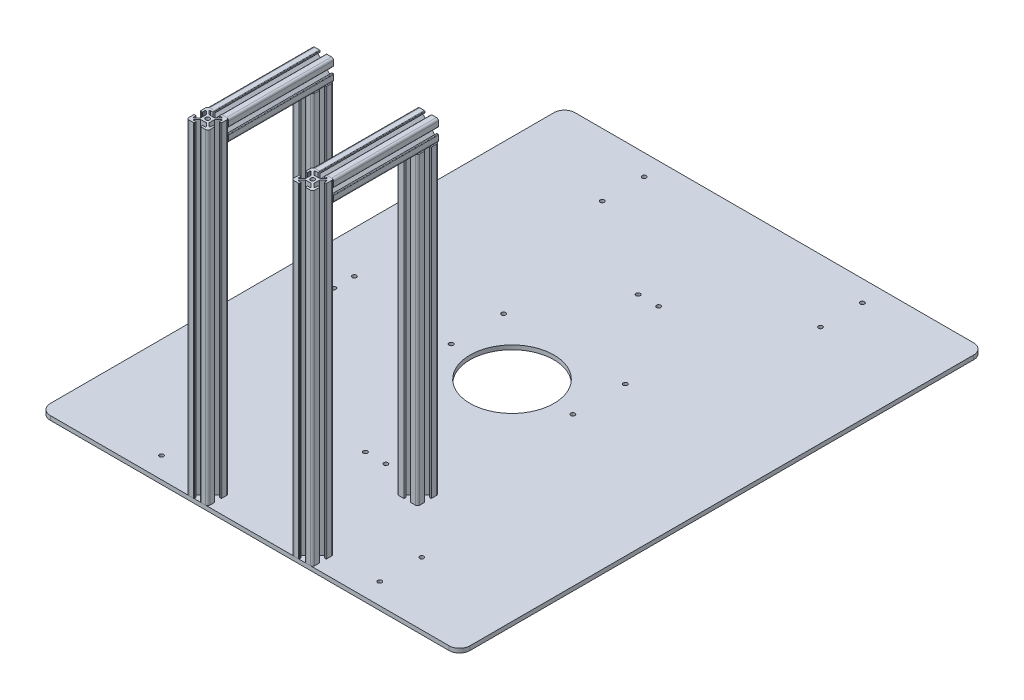
from build123d import *
from OCP.BRepAlgoAPI import BRepAlgoAPI_Cut
from OCP.TopTools import TopTools_ListOfShape

# Parameters (mm, degrees)
SKETCH1_W                             = 400
SKETCH1_H                             = 500
SKETCH1_R                             = 40
BOSS_EXTRUDE1_DEPTH                   = 4
ALUMINIUM_START                       = 4
ALUMINIUM_PROFILE_20_20_2_OUTLINE_R   = 2
ALUMINIUM_PROFILE_20_20_2_DEPTH       = 310
ALUMINIUM_START_2                     = 130
ALUMINIUM_PROFILE_20_20_2_2_OUTLINE_R = 2
ALUMINIUM_PROFILE_20_20_2_2_DEPTH     = 100
ALUMINIUM_PROFILE_20_20_2_3_OUTLINE_R = 2
ALUMINIUM_PROFILE_20_20_2_3_DEPTH     = 290
ALUMINIUM_PROFILE_20_20_2_4_OUTLINE_R = 2
ALUMINIUM_PROFILE_20_20_2_4_DEPTH     = 310
ALUMINIUM_PROFILE_20_20_2_5_OUTLINE_R = 2
ALUMINIUM_PROFILE_20_20_2_5_DEPTH     = 100
ALUMINIUM_PROFILE_20_20_2_6_OUTLINE_R = 2
ALUMINIUM_PROFILE_20_20_2_6_DEPTH     = 290
SKETCH4_R                             = 2
CUT_EXTRUDE1_DEPTH                    = 10
SKETCH5_R                             = 2
CUT_EXTRUDE2_DEPTH                    = 10
SKETCH6_R                             = 2
CUT_EXTRUDE3_DEPTH                    = 10
FILLET1_R                             = 10
SKETCH7_R                             = 2
CUT_EXTRUDE4_DEPTH                    = 10


with BuildPart() as part:
    # Sketch1 → Boss-Extrude1 (new body)
    with BuildSketch(Plane(origin=(0, 0, 0), x_dir=(1, 0, 0), z_dir=(0, 1, 0))):
        Rectangle(SKETCH1_W, SKETCH1_H)
        with Locations(Location((0, 0, 0), (0, 0, 270))):
            Circle(SKETCH1_R, mode=Mode.SUBTRACT)
    extrude(amount=BOSS_EXTRUDE1_DEPTH)

    # Sketch5 → Cut-Extrude2 (cut)
    with BuildSketch(Plane.XZ):
        with Locations(Location((-58, -50, 0), (0, 0, 270))):
            Circle(SKETCH5_R)
        with Locations(Location((-58, 0, 0), (0, 0, 270))):
            Circle(SKETCH5_R)
        with Locations(Location((58, 0, 0), (0, 0, 270))):
            Circle(SKETCH5_R)
        with Locations(Location((58, -50, 0), (0, 0, 270))):
            Circle(SKETCH5_R)
    extrude(amount=-CUT_EXTRUDE2_DEPTH, mode=Mode.SUBTRACT)

    # Sketch6 → Cut-Extrude3 (cut)
    with BuildSketch(Plane.XZ):
        with Locations(Location((104, 230, 0), (0, 0, 270))):
            Circle(SKETCH6_R)
        with Locations(Location((104, 190, 0), (0, 0, 270))):
            Circle(SKETCH6_R)
        with Locations(Location((-104, 190, 0), (0, 0, 270))):
            Circle(SKETCH6_R)
        with Locations(Location((-104, 230, 0), (0, 0, 270))):
            Circle(SKETCH6_R)
        with Locations(Location((104, -190, 0), (0, 0, 270))):
            Circle(SKETCH6_R)
        with Locations(Location((104, -230, 0), (0, 0, 270))):
            Circle(SKETCH6_R)
        with Locations(Location((-104, -190, 0), (0, 0, 270))):
            Circle(SKETCH6_R)
        with Locations(Location((-104, -230, 0), (0, 0, 270))):
            Circle(SKETCH6_R)
    extrude(amount=-CUT_EXTRUDE3_DEPTH, mode=Mode.SUBTRACT)

    # Fillet1
    fillet1_edges = [part.edges().sort_by_distance(p)[0] for p in [
        (200, 2, 250),
        (-200, 2, 250),
        (-200, 2, -250),
        (200, 2, -250),
    ]]
    fillet(fillet1_edges, radius=FILLET1_R)

    # Sketch7 → Cut-Extrude4 (cut)
    with BuildSketch(Plane.XZ):
        with Locations(Location((9.75, -130, 0), (0, 0, 270))):
            Circle(SKETCH7_R)
        with Locations(Location((-9.75, -130, 0), (0, 0, 270))):
            Circle(SKETCH7_R)
        with Locations(Location((-9.75, 130, 0), (0, 0, 270))):
            Circle(SKETCH7_R)
        with Locations(Location((9.75, 130, 0), (0, 0, 270))):
            Circle(SKETCH7_R)
        with Locations(Location((-160, 9.75, 0), (0, 0, 270))):
            Circle(SKETCH7_R)
        with Locations(Location((-160, -9.75, 0), (0, 0, 270))):
            Circle(SKETCH7_R)
    extrude(amount=-CUT_EXTRUDE4_DEPTH, mode=Mode.SUBTRACT)


with BuildPart() as body_2:
    # Aluminium profile 20×20(2): read off the stored shape, not the designer's step
    # Aluminium profile 20×20(2) outline → Aluminium profile 20×20(2) (new body)
    with BuildSketch(Plane(origin=(0, 0, 0), x_dir=(1, 0, 0), z_dir=(0, 1, 0)).offset(ALUMINIUM_START)):
        with BuildLine():
            ThreePointArc((-42.001429645, -250), (-40.587216083, -249.414213562), (-40.001429645, -248))
            Line((-40.001429645, -248), (-40.001429645, -243.5))
            ThreePointArc((-40.001429645, -243.5), (-40.147876254, -243.146446609), (-40.501429645, -243))
            Line((-40.501429645, -243), (-41.501429645, -243))
            ThreePointArc((-41.501429645, -243), (-41.854983036, -243.146446609), (-42.001429645, -243.5))
            Line((-42.001429645, -243.5), (-42.001429645, -245.412091861))
            ThreePointArc((-42.001429645, -245.412091861), (-42.308999453, -245.873579263), (-42.853312131, -245.767308297))
            Line((-42.853312131, -245.767308297), (-46, -242.650154242))
            Line((-46, -242.650154242), (-46, -237.349845758))
            Line((-46, -237.349845758), (-42.853312131, -234.232691703))
            ThreePointArc((-42.853312131, -234.232691703), (-42.308999453, -234.126420737), (-42.001429645, -234.587908139))
            Line((-42.001429645, -234.587908139), (-42.001429645, -236.5))
            ThreePointArc((-42.001429645, -236.5), (-41.854983036, -236.853553391), (-41.501429645, -237))
            Line((-41.501429645, -237), (-40.501429645, -237))
            ThreePointArc((-40.501429645, -237), (-40.147876254, -236.853553391), (-40.001429645, -236.5))
            Line((-40.001429645, -236.5), (-40.001429645, -232))
            ThreePointArc((-40.001429645, -232), (-40.587216083, -230.585786438), (-42.001429645, -230))
            Line((-42.001429645, -230), (-46.501429645, -230))
            ThreePointArc((-46.501429645, -230), (-46.854983036, -230.146446609), (-47.001429645, -230.5))
            Line((-47.001429645, -230.5), (-47.001429645, -231.5))
            ThreePointArc((-47.001429645, -231.5), (-46.854983036, -231.853553391), (-46.501429645, -232))
            Line((-46.501429645, -232), (-44.579081635, -232))
            ThreePointArc((-44.579081635, -232), (-44.117734535, -232.307233683), (-44.223352909, -232.851364588))
            Line((-44.223352909, -232.851364588), (-47.333360347, -236))
            Line((-47.333360347, -236), (-52.666639653, -236))
            Line((-52.666639653, -236), (-55.776647091, -232.851364588))
            ThreePointArc((-55.776647091, -232.851364588), (-55.882265465, -232.307233683), (-55.420918365, -232))
            Line((-55.420918365, -232), (-52.998570355, -232))
            Line((-52.998570355, -232), (-52.998570355, -230))
            Line((-52.998570355, -230), (-57.998570355, -230))
            ThreePointArc((-57.998570355, -230), (-59.412783917, -230.585786438), (-59.998570355, -232))
            Line((-59.998570355, -232), (-59.998570355, -236.5))
            ThreePointArc((-59.998570355, -236.5), (-59.852123746, -236.853553391), (-59.498570355, -237))
            Line((-59.498570355, -237), (-58.498570355, -237))
            ThreePointArc((-58.498570355, -237), (-58.145016964, -236.853553391), (-57.998570355, -236.5))
            Line((-57.998570355, -236.5), (-57.998570355, -234.587908139))
            ThreePointArc((-57.998570355, -234.587908139), (-57.691000547, -234.126420737), (-57.146687869, -234.232691703))
            Line((-57.146687869, -234.232691703), (-54, -237.349845758))
            Line((-54, -237.349845758), (-54, -242.650154242))
            Line((-54, -242.650154242), (-57.146687869, -245.767308297))
            ThreePointArc((-57.146687869, -245.767308297), (-57.691000547, -245.873579263), (-57.998570355, -245.412091861))
            Line((-57.998570355, -245.412091861), (-57.998570355, -243.5))
            ThreePointArc((-57.998570355, -243.5), (-58.145016964, -243.146446609), (-58.498570355, -243))
            Line((-58.498570355, -243), (-59.498570355, -243))
            ThreePointArc((-59.498570355, -243), (-59.852123746, -243.146446609), (-59.998570355, -243.5))
            Line((-59.998570355, -243.5), (-59.998570355, -248))
            ThreePointArc((-59.998570355, -248), (-59.412783917, -249.414213562), (-57.998570355, -250))
            Line((-57.998570355, -250), (-53.498570355, -250))
            ThreePointArc((-53.498570355, -250), (-53.145016964, -249.853553391), (-52.998570355, -249.5))
            Line((-52.998570355, -249.5), (-52.998570355, -248.5))
            ThreePointArc((-52.998570355, -248.5), (-53.145016964, -248.146446609), (-53.498570355, -248))
            Line((-53.498570355, -248), (-55.420918365, -248))
            ThreePointArc((-55.420918365, -248), (-55.882265465, -247.692766317), (-55.776647091, -247.148635412))
            Line((-55.776647091, -247.148635412), (-52.666639653, -244))
            Line((-52.666639653, -244), (-47.333360347, -244))
            Line((-47.333360347, -244), (-44.223352909, -247.148635412))
            ThreePointArc((-44.223352909, -247.148635412), (-44.117734535, -247.692766317), (-44.579081635, -248))
            Line((-44.579081635, -248), (-46.501429645, -248))
            ThreePointArc((-46.501429645, -248), (-46.854983036, -248.146446609), (-47.001429645, -248.5))
            Line((-47.001429645, -248.5), (-47.001429645, -249.5))
            ThreePointArc((-47.001429645, -249.5), (-46.854983036, -249.853553391), (-46.501429645, -250))
            Line((-46.501429645, -250), (-42.001429645, -250))
        make_face()
        with Locations((-50, -240)):
            Circle(ALUMINIUM_PROFILE_20_20_2_OUTLINE_R, mode=Mode.SUBTRACT)
    extrude(amount=ALUMINIUM_PROFILE_20_20_2_DEPTH)


with BuildPart() as body_3:
    # Aluminium profile 20_20_2 2 outline → Aluminium profile 20_20_2 2 (new body)
    with BuildSketch(Plane.XY.offset(ALUMINIUM_START_2)):
        with BuildLine():
            Line((-42.001429645, 314), (-46.501429645, 314))
            ThreePointArc((-46.501429645, 314), (-46.854983036, 313.853553391), (-47.001429645, 313.5))
            Line((-47.001429645, 313.5), (-47.001429645, 312.5))
            ThreePointArc((-47.001429645, 312.5), (-46.854983036, 312.146446609), (-46.501429645, 312))
            Line((-46.501429645, 312), (-44.579081635, 312))
            ThreePointArc((-44.579081635, 312), (-44.117734535, 311.692766317), (-44.223352909, 311.148635412))
            Line((-44.223352909, 311.148635412), (-47.333360347, 308))
            Line((-47.333360347, 308), (-52.666639653, 308))
            Line((-52.666639653, 308), (-55.776647091, 311.148635412))
            ThreePointArc((-55.776647091, 311.148635412), (-55.882265465, 311.692766317), (-55.420918365, 312))
            Line((-55.420918365, 312), (-53.498570355, 312))
            ThreePointArc((-53.498570355, 312), (-53.145016964, 312.146446609), (-52.998570355, 312.5))
            Line((-52.998570355, 312.5), (-52.998570355, 313.5))
            ThreePointArc((-52.998570355, 313.5), (-53.145016964, 313.853553391), (-53.498570355, 314))
            Line((-53.498570355, 314), (-57.998570355, 314))
            ThreePointArc((-57.998570355, 314), (-59.412783917, 313.414213562), (-59.998570355, 312))
            Line((-59.998570355, 312), (-59.998570355, 307.5))
            ThreePointArc((-59.998570355, 307.5), (-59.852123746, 307.146446609), (-59.498570355, 307))
            Line((-59.498570355, 307), (-58.498570355, 307))
            ThreePointArc((-58.498570355, 307), (-58.145016964, 307.146446609), (-57.998570355, 307.5))
            Line((-57.998570355, 307.5), (-57.998570355, 309.412091861))
            ThreePointArc((-57.998570355, 309.412091861), (-57.691000547, 309.873579263), (-57.146687869, 309.767308297))
            Line((-57.146687869, 309.767308297), (-54, 306.650154242))
            Line((-54, 306.650154242), (-54, 301.349845758))
            Line((-54, 301.349845758), (-57.146687869, 298.232691703))
            ThreePointArc((-57.146687869, 298.232691703), (-57.691000547, 298.126420737), (-57.998570355, 298.587908139))
            Line((-57.998570355, 298.587908139), (-57.998570355, 300.5))
            ThreePointArc((-57.998570355, 300.5), (-58.145016964, 300.853553391), (-58.498570355, 301))
            Line((-58.498570355, 301), (-59.498570355, 301))
            ThreePointArc((-59.498570355, 301), (-59.852123746, 300.853553391), (-59.998570355, 300.5))
            Line((-59.998570355, 300.5), (-59.998570355, 296))
            ThreePointArc((-59.998570355, 296), (-59.412783917, 294.585786438), (-57.998570355, 294))
            Line((-57.998570355, 294), (-52.998570355, 294))
            Line((-52.998570355, 294), (-52.998570355, 296))
            Line((-52.998570355, 296), (-55.420918365, 296))
            ThreePointArc((-55.420918365, 296), (-55.882265465, 296.307233683), (-55.776647091, 296.851364588))
            Line((-55.776647091, 296.851364588), (-52.666639653, 300))
            Line((-52.666639653, 300), (-47.333360347, 300))
            Line((-47.333360347, 300), (-44.223352909, 296.851364588))
            ThreePointArc((-44.223352909, 296.851364588), (-44.117734535, 296.307233683), (-44.579081635, 296))
            Line((-44.579081635, 296), (-46.501429645, 296))
            ThreePointArc((-46.501429645, 296), (-46.854983036, 295.853553391), (-47.001429645, 295.5))
            Line((-47.001429645, 295.5), (-47.001429645, 294.5))
            ThreePointArc((-47.001429645, 294.5), (-46.854983036, 294.146446609), (-46.501429645, 294))
            Line((-46.501429645, 294), (-42.001429645, 294))
            ThreePointArc((-42.001429645, 294), (-40.587216083, 294.585786438), (-40.001429645, 296))
            Line((-40.001429645, 296), (-40.001429645, 300.5))
            ThreePointArc((-40.001429645, 300.5), (-40.147876254, 300.853553391), (-40.501429645, 301))
            Line((-40.501429645, 301), (-41.501429645, 301))
            ThreePointArc((-41.501429645, 301), (-41.854983036, 300.853553391), (-42.001429645, 300.5))
            Line((-42.001429645, 300.5), (-42.001429645, 298.587908139))
            ThreePointArc((-42.001429645, 298.587908139), (-42.308999453, 298.126420737), (-42.853312131, 298.232691703))
            Line((-42.853312131, 298.232691703), (-46, 301.349845758))
            Line((-46, 301.349845758), (-46, 306.650154242))
            Line((-46, 306.650154242), (-42.853312131, 309.767308297))
            ThreePointArc((-42.853312131, 309.767308297), (-42.308999453, 309.873579263), (-42.001429645, 309.412091861))
            Line((-42.001429645, 309.412091861), (-42.001429645, 307.5))
            ThreePointArc((-42.001429645, 307.5), (-41.854983036, 307.146446609), (-41.501429645, 307))
            Line((-41.501429645, 307), (-40.501429645, 307))
            ThreePointArc((-40.501429645, 307), (-40.147876254, 307.146446609), (-40.001429645, 307.5))
            Line((-40.001429645, 307.5), (-40.001429645, 312))
            ThreePointArc((-40.001429645, 312), (-40.587216083, 313.414213562), (-42.001429645, 314))
        make_face()
        with Locations((-50, 304)):
            Circle(ALUMINIUM_PROFILE_20_20_2_2_OUTLINE_R, mode=Mode.SUBTRACT)
    extrude(amount=ALUMINIUM_PROFILE_20_20_2_2_DEPTH)


with BuildPart() as body_4:
    # Aluminium profile 20_20_2 3 outline → Aluminium profile 20_20_2 3 (new body)
    with BuildSketch(Plane(origin=(0, 0, 0), x_dir=(1, 0, 0), z_dir=(0, 1, 0)).offset(ALUMINIUM_START)):
        with BuildLine():
            Line((-42.001429645, -130), (-46.501429645, -130))
            ThreePointArc((-46.501429645, -130), (-46.854983036, -130.146446609), (-47.001429645, -130.5))
            Line((-47.001429645, -130.5), (-47.001429645, -131.5))
            ThreePointArc((-47.001429645, -131.5), (-46.854983036, -131.853553391), (-46.501429645, -132))
            Line((-46.501429645, -132), (-44.579081635, -132))
            ThreePointArc((-44.579081635, -132), (-44.117734535, -132.307233683), (-44.223352909, -132.851364588))
            Line((-44.223352909, -132.851364588), (-47.333360347, -136))
            Line((-47.333360347, -136), (-52.666639653, -136))
            Line((-52.666639653, -136), (-55.776647091, -132.851364588))
            ThreePointArc((-55.776647091, -132.851364588), (-55.882265465, -132.307233683), (-55.420918365, -132))
            Line((-55.420918365, -132), (-53.498570355, -132))
            ThreePointArc((-53.498570355, -132), (-53.145016964, -131.853553391), (-52.998570355, -131.5))
            Line((-52.998570355, -131.5), (-52.998570355, -130.5))
            ThreePointArc((-52.998570355, -130.5), (-53.145016964, -130.146446609), (-53.498570355, -130))
            Line((-53.498570355, -130), (-57.998570355, -130))
            ThreePointArc((-57.998570355, -130), (-59.412783917, -130.585786438), (-59.998570355, -132))
            Line((-59.998570355, -132), (-59.998570355, -136.5))
            ThreePointArc((-59.998570355, -136.5), (-59.852123746, -136.853553391), (-59.498570355, -137))
            Line((-59.498570355, -137), (-58.498570355, -137))
            ThreePointArc((-58.498570355, -137), (-58.145016964, -136.853553391), (-57.998570355, -136.5))
            Line((-57.998570355, -136.5), (-57.998570355, -134.587908139))
            ThreePointArc((-57.998570355, -134.587908139), (-57.691000547, -134.126420737), (-57.146687869, -134.232691703))
            Line((-57.146687869, -134.232691703), (-54, -137.349845758))
            Line((-54, -137.349845758), (-54, -142.650154242))
            Line((-54, -142.650154242), (-57.146687869, -145.767308297))
            ThreePointArc((-57.146687869, -145.767308297), (-57.691000547, -145.873579263), (-57.998570355, -145.412091861))
            Line((-57.998570355, -145.412091861), (-57.998570355, -143.5))
            ThreePointArc((-57.998570355, -143.5), (-58.145016964, -143.146446609), (-58.498570355, -143))
            Line((-58.498570355, -143), (-59.498570355, -143))
            ThreePointArc((-59.498570355, -143), (-59.852123746, -143.146446609), (-59.998570355, -143.5))
            Line((-59.998570355, -143.5), (-59.998570355, -148))
            ThreePointArc((-59.998570355, -148), (-59.412783917, -149.414213562), (-57.998570355, -150))
            Line((-57.998570355, -150), (-52.998570355, -150))
            Line((-52.998570355, -150), (-52.998570355, -148))
            Line((-52.998570355, -148), (-55.420918365, -148))
            ThreePointArc((-55.420918365, -148), (-55.882265465, -147.692766317), (-55.776647091, -147.148635412))
            Line((-55.776647091, -147.148635412), (-52.666639653, -144))
            Line((-52.666639653, -144), (-47.333360347, -144))
            Line((-47.333360347, -144), (-44.223352909, -147.148635412))
            ThreePointArc((-44.223352909, -147.148635412), (-44.117734535, -147.692766317), (-44.579081635, -148))
            Line((-44.579081635, -148), (-46.501429645, -148))
            ThreePointArc((-46.501429645, -148), (-46.854983036, -148.146446609), (-47.001429645, -148.5))
            Line((-47.001429645, -148.5), (-47.001429645, -149.5))
            ThreePointArc((-47.001429645, -149.5), (-46.854983036, -149.853553391), (-46.501429645, -150))
            Line((-46.501429645, -150), (-42.001429645, -150))
            ThreePointArc((-42.001429645, -150), (-40.587216083, -149.414213562), (-40.001429645, -148))
            Line((-40.001429645, -148), (-40.001429645, -143.5))
            ThreePointArc((-40.001429645, -143.5), (-40.147876254, -143.146446609), (-40.501429645, -143))
            Line((-40.501429645, -143), (-41.501429645, -143))
            ThreePointArc((-41.501429645, -143), (-41.854983036, -143.146446609), (-42.001429645, -143.5))
            Line((-42.001429645, -143.5), (-42.001429645, -145.412091861))
            ThreePointArc((-42.001429645, -145.412091861), (-42.308999453, -145.873579263), (-42.853312131, -145.767308297))
            Line((-42.853312131, -145.767308297), (-46, -142.650154242))
            Line((-46, -142.650154242), (-46, -137.349845758))
            Line((-46, -137.349845758), (-42.853312131, -134.232691703))
            ThreePointArc((-42.853312131, -134.232691703), (-42.308999453, -134.126420737), (-42.001429645, -134.587908139))
            Line((-42.001429645, -134.587908139), (-42.001429645, -136.5))
            ThreePointArc((-42.001429645, -136.5), (-41.854983036, -136.853553391), (-41.501429645, -137))
            Line((-41.501429645, -137), (-40.501429645, -137))
            ThreePointArc((-40.501429645, -137), (-40.147876254, -136.853553391), (-40.001429645, -136.5))
            Line((-40.001429645, -136.5), (-40.001429645, -132))
            ThreePointArc((-40.001429645, -132), (-40.587216083, -130.585786438), (-42.001429645, -130))
        make_face()
        with Locations((-50, -140)):
            Circle(ALUMINIUM_PROFILE_20_20_2_3_OUTLINE_R, mode=Mode.SUBTRACT)
    extrude(amount=ALUMINIUM_PROFILE_20_20_2_3_DEPTH)


with BuildPart() as body_5:
    # Aluminium profile 20_20_2 4 outline → Aluminium profile 20_20_2 4 (new body)
    with BuildSketch(Plane(origin=(0, 0, 0), x_dir=(1, 0, 0), z_dir=(0, 1, 0)).offset(ALUMINIUM_START)):
        with BuildLine():
            ThreePointArc((57.998570355, -250), (59.412783917, -249.414213562), (59.998570355, -248))
            Line((59.998570355, -248), (59.998570355, -243.5))
            ThreePointArc((59.998570355, -243.5), (59.852123746, -243.146446609), (59.498570355, -243))
            Line((59.498570355, -243), (58.498570355, -243))
            ThreePointArc((58.498570355, -243), (58.145016964, -243.146446609), (57.998570355, -243.5))
            Line((57.998570355, -243.5), (57.998570355, -245.412091861))
            ThreePointArc((57.998570355, -245.412091861), (57.691000547, -245.873579263), (57.146687869, -245.767308297))
            Line((57.146687869, -245.767308297), (54, -242.650154242))
            Line((54, -242.650154242), (54, -237.349845758))
            Line((54, -237.349845758), (57.146687869, -234.232691703))
            ThreePointArc((57.146687869, -234.232691703), (57.691000547, -234.126420737), (57.998570355, -234.587908139))
            Line((57.998570355, -234.587908139), (57.998570355, -236.5))
            ThreePointArc((57.998570355, -236.5), (58.145016964, -236.853553391), (58.498570355, -237))
            Line((58.498570355, -237), (59.498570355, -237))
            ThreePointArc((59.498570355, -237), (59.852123746, -236.853553391), (59.998570355, -236.5))
            Line((59.998570355, -236.5), (59.998570355, -232))
            ThreePointArc((59.998570355, -232), (59.412783917, -230.585786438), (57.998570355, -230))
            Line((57.998570355, -230), (53.498570355, -230))
            ThreePointArc((53.498570355, -230), (53.145016964, -230.146446609), (52.998570355, -230.5))
            Line((52.998570355, -230.5), (52.998570355, -231.5))
            ThreePointArc((52.998570355, -231.5), (53.145016964, -231.853553391), (53.498570355, -232))
            Line((53.498570355, -232), (55.420918365, -232))
            ThreePointArc((55.420918365, -232), (55.882265465, -232.307233683), (55.776647091, -232.851364588))
            Line((55.776647091, -232.851364588), (52.666639653, -236))
            Line((52.666639653, -236), (47.333360347, -236))
            Line((47.333360347, -236), (44.223352909, -232.851364588))
            ThreePointArc((44.223352909, -232.851364588), (44.117734535, -232.307233683), (44.579081635, -232))
            Line((44.579081635, -232), (47.001429645, -232))
            Line((47.001429645, -232), (47.001429645, -230))
            Line((47.001429645, -230), (42.001429645, -230))
            ThreePointArc((42.001429645, -230), (40.587216083, -230.585786438), (40.001429645, -232))
            Line((40.001429645, -232), (40.001429645, -236.5))
            ThreePointArc((40.001429645, -236.5), (40.147876254, -236.853553391), (40.501429645, -237))
            Line((40.501429645, -237), (41.501429645, -237))
            ThreePointArc((41.501429645, -237), (41.854983036, -236.853553391), (42.001429645, -236.5))
            Line((42.001429645, -236.5), (42.001429645, -234.587908139))
            ThreePointArc((42.001429645, -234.587908139), (42.308999453, -234.126420737), (42.853312131, -234.232691703))
            Line((42.853312131, -234.232691703), (46, -237.349845758))
            Line((46, -237.349845758), (46, -242.650154242))
            Line((46, -242.650154242), (42.853312131, -245.767308297))
            ThreePointArc((42.853312131, -245.767308297), (42.308999453, -245.873579263), (42.001429645, -245.412091861))
            Line((42.001429645, -245.412091861), (42.001429645, -243.5))
            ThreePointArc((42.001429645, -243.5), (41.854983036, -243.146446609), (41.501429645, -243))
            Line((41.501429645, -243), (40.501429645, -243))
            ThreePointArc((40.501429645, -243), (40.147876254, -243.146446609), (40.001429645, -243.5))
            Line((40.001429645, -243.5), (40.001429645, -248))
            ThreePointArc((40.001429645, -248), (40.587216083, -249.414213562), (42.001429645, -250))
            Line((42.001429645, -250), (46.501429645, -250))
            ThreePointArc((46.501429645, -250), (46.854983036, -249.853553391), (47.001429645, -249.5))
            Line((47.001429645, -249.5), (47.001429645, -248.5))
            ThreePointArc((47.001429645, -248.5), (46.854983036, -248.146446609), (46.501429645, -248))
            Line((46.501429645, -248), (44.579081635, -248))
            ThreePointArc((44.579081635, -248), (44.117734535, -247.692766317), (44.223352909, -247.148635412))
            Line((44.223352909, -247.148635412), (47.333360347, -244))
            Line((47.333360347, -244), (52.666639653, -244))
            Line((52.666639653, -244), (55.776647091, -247.148635412))
            ThreePointArc((55.776647091, -247.148635412), (55.882265465, -247.692766317), (55.420918365, -248))
            Line((55.420918365, -248), (53.498570355, -248))
            ThreePointArc((53.498570355, -248), (53.145016964, -248.146446609), (52.998570355, -248.5))
            Line((52.998570355, -248.5), (52.998570355, -249.5))
            ThreePointArc((52.998570355, -249.5), (53.145016964, -249.853553391), (53.498570355, -250))
            Line((53.498570355, -250), (57.998570355, -250))
        make_face()
        with Locations((50, -240)):
            Circle(ALUMINIUM_PROFILE_20_20_2_4_OUTLINE_R, mode=Mode.SUBTRACT)
    extrude(amount=ALUMINIUM_PROFILE_20_20_2_4_DEPTH)


with BuildPart() as body_6:
    # Aluminium profile 20_20_2 5 outline → Aluminium profile 20_20_2 5 (new body)
    with BuildSketch(Plane.XY.offset(ALUMINIUM_START_2)):
        with BuildLine():
            Line((57.998570355, 314), (53.498570355, 314))
            ThreePointArc((53.498570355, 314), (53.145016964, 313.853553391), (52.998570355, 313.5))
            Line((52.998570355, 313.5), (52.998570355, 312.5))
            ThreePointArc((52.998570355, 312.5), (53.145016964, 312.146446609), (53.498570355, 312))
            Line((53.498570355, 312), (55.420918365, 312))
            ThreePointArc((55.420918365, 312), (55.882265465, 311.692766317), (55.776647091, 311.148635412))
            Line((55.776647091, 311.148635412), (52.666639653, 308))
            Line((52.666639653, 308), (47.333360347, 308))
            Line((47.333360347, 308), (44.223352909, 311.148635412))
            ThreePointArc((44.223352909, 311.148635412), (44.117734535, 311.692766317), (44.579081635, 312))
            Line((44.579081635, 312), (46.501429645, 312))
            ThreePointArc((46.501429645, 312), (46.854983036, 312.146446609), (47.001429645, 312.5))
            Line((47.001429645, 312.5), (47.001429645, 313.5))
            ThreePointArc((47.001429645, 313.5), (46.854983036, 313.853553391), (46.501429645, 314))
            Line((46.501429645, 314), (42.001429645, 314))
            ThreePointArc((42.001429645, 314), (40.587216083, 313.414213562), (40.001429645, 312))
            Line((40.001429645, 312), (40.001429645, 307.5))
            ThreePointArc((40.001429645, 307.5), (40.147876254, 307.146446609), (40.501429645, 307))
            Line((40.501429645, 307), (41.501429645, 307))
            ThreePointArc((41.501429645, 307), (41.854983036, 307.146446609), (42.001429645, 307.5))
            Line((42.001429645, 307.5), (42.001429645, 309.412091861))
            ThreePointArc((42.001429645, 309.412091861), (42.308999453, 309.873579263), (42.853312131, 309.767308297))
            Line((42.853312131, 309.767308297), (46, 306.650154242))
            Line((46, 306.650154242), (46, 301.349845758))
            Line((46, 301.349845758), (42.853312131, 298.232691703))
            ThreePointArc((42.853312131, 298.232691703), (42.308999453, 298.126420737), (42.001429645, 298.587908139))
            Line((42.001429645, 298.587908139), (42.001429645, 300.5))
            ThreePointArc((42.001429645, 300.5), (41.854983036, 300.853553391), (41.501429645, 301))
            Line((41.501429645, 301), (40.501429645, 301))
            ThreePointArc((40.501429645, 301), (40.147876254, 300.853553391), (40.001429645, 300.5))
            Line((40.001429645, 300.5), (40.001429645, 296))
            ThreePointArc((40.001429645, 296), (40.587216083, 294.585786438), (42.001429645, 294))
            Line((42.001429645, 294), (47.001429645, 294))
            Line((47.001429645, 294), (47.001429645, 296))
            Line((47.001429645, 296), (44.579081635, 296))
            ThreePointArc((44.579081635, 296), (44.117734535, 296.307233683), (44.223352909, 296.851364588))
            Line((44.223352909, 296.851364588), (47.333360347, 300))
            Line((47.333360347, 300), (52.666639653, 300))
            Line((52.666639653, 300), (55.776647091, 296.851364588))
            ThreePointArc((55.776647091, 296.851364588), (55.882265465, 296.307233683), (55.420918365, 296))
            Line((55.420918365, 296), (53.498570355, 296))
            ThreePointArc((53.498570355, 296), (53.145016964, 295.853553391), (52.998570355, 295.5))
            Line((52.998570355, 295.5), (52.998570355, 294.5))
            ThreePointArc((52.998570355, 294.5), (53.145016964, 294.146446609), (53.498570355, 294))
            Line((53.498570355, 294), (57.998570355, 294))
            ThreePointArc((57.998570355, 294), (59.412783917, 294.585786438), (59.998570355, 296))
            Line((59.998570355, 296), (59.998570355, 300.5))
            ThreePointArc((59.998570355, 300.5), (59.852123746, 300.853553391), (59.498570355, 301))
            Line((59.498570355, 301), (58.498570355, 301))
            ThreePointArc((58.498570355, 301), (58.145016964, 300.853553391), (57.998570355, 300.5))
            Line((57.998570355, 300.5), (57.998570355, 298.587908139))
            ThreePointArc((57.998570355, 298.587908139), (57.691000547, 298.126420737), (57.146687869, 298.232691703))
            Line((57.146687869, 298.232691703), (54, 301.349845758))
            Line((54, 301.349845758), (54, 306.650154242))
            Line((54, 306.650154242), (57.146687869, 309.767308297))
            ThreePointArc((57.146687869, 309.767308297), (57.691000547, 309.873579263), (57.998570355, 309.412091861))
            Line((57.998570355, 309.412091861), (57.998570355, 307.5))
            ThreePointArc((57.998570355, 307.5), (58.145016964, 307.146446609), (58.498570355, 307))
            Line((58.498570355, 307), (59.498570355, 307))
            ThreePointArc((59.498570355, 307), (59.852123746, 307.146446609), (59.998570355, 307.5))
            Line((59.998570355, 307.5), (59.998570355, 312))
            ThreePointArc((59.998570355, 312), (59.412783917, 313.414213562), (57.998570355, 314))
        make_face()
        with Locations((50, 304)):
            Circle(ALUMINIUM_PROFILE_20_20_2_5_OUTLINE_R, mode=Mode.SUBTRACT)
    extrude(amount=ALUMINIUM_PROFILE_20_20_2_5_DEPTH)


with BuildPart() as body_7:
    # Aluminium profile 20_20_2 6 outline → Aluminium profile 20_20_2 6 (new body)
    with BuildSketch(Plane(origin=(0, 0, 0), x_dir=(1, 0, 0), z_dir=(0, 1, 0)).offset(ALUMINIUM_START)):
        with BuildLine():
            Line((57.998570355, -130), (53.498570355, -130))
            ThreePointArc((53.498570355, -130), (53.145016964, -130.146446609), (52.998570355, -130.5))
            Line((52.998570355, -130.5), (52.998570355, -131.5))
            ThreePointArc((52.998570355, -131.5), (53.145016964, -131.853553391), (53.498570355, -132))
            Line((53.498570355, -132), (55.420918365, -132))
            ThreePointArc((55.420918365, -132), (55.882265465, -132.307233683), (55.776647091, -132.851364588))
            Line((55.776647091, -132.851364588), (52.666639653, -136))
            Line((52.666639653, -136), (47.333360347, -136))
            Line((47.333360347, -136), (44.223352909, -132.851364588))
            ThreePointArc((44.223352909, -132.851364588), (44.117734535, -132.307233683), (44.579081635, -132))
            Line((44.579081635, -132), (46.501429645, -132))
            ThreePointArc((46.501429645, -132), (46.854983036, -131.853553391), (47.001429645, -131.5))
            Line((47.001429645, -131.5), (47.001429645, -130.5))
            ThreePointArc((47.001429645, -130.5), (46.854983036, -130.146446609), (46.501429645, -130))
            Line((46.501429645, -130), (42.001429645, -130))
            ThreePointArc((42.001429645, -130), (40.587216083, -130.585786438), (40.001429645, -132))
            Line((40.001429645, -132), (40.001429645, -136.5))
            ThreePointArc((40.001429645, -136.5), (40.147876254, -136.853553391), (40.501429645, -137))
            Line((40.501429645, -137), (41.501429645, -137))
            ThreePointArc((41.501429645, -137), (41.854983036, -136.853553391), (42.001429645, -136.5))
            Line((42.001429645, -136.5), (42.001429645, -134.587908139))
            ThreePointArc((42.001429645, -134.587908139), (42.308999453, -134.126420737), (42.853312131, -134.232691703))
            Line((42.853312131, -134.232691703), (46, -137.349845758))
            Line((46, -137.349845758), (46, -142.650154242))
            Line((46, -142.650154242), (42.853312131, -145.767308297))
            ThreePointArc((42.853312131, -145.767308297), (42.308999453, -145.873579263), (42.001429645, -145.412091861))
            Line((42.001429645, -145.412091861), (42.001429645, -143.5))
            ThreePointArc((42.001429645, -143.5), (41.854983036, -143.146446609), (41.501429645, -143))
            Line((41.501429645, -143), (40.501429645, -143))
            ThreePointArc((40.501429645, -143), (40.147876254, -143.146446609), (40.001429645, -143.5))
            Line((40.001429645, -143.5), (40.001429645, -148))
            ThreePointArc((40.001429645, -148), (40.587216083, -149.414213562), (42.001429645, -150))
            Line((42.001429645, -150), (47.001429645, -150))
            Line((47.001429645, -150), (47.001429645, -148))
            Line((47.001429645, -148), (44.579081635, -148))
            ThreePointArc((44.579081635, -148), (44.117734535, -147.692766317), (44.223352909, -147.148635412))
            Line((44.223352909, -147.148635412), (47.333360347, -144))
            Line((47.333360347, -144), (52.666639653, -144))
            Line((52.666639653, -144), (55.776647091, -147.148635412))
            ThreePointArc((55.776647091, -147.148635412), (55.882265465, -147.692766317), (55.420918365, -148))
            Line((55.420918365, -148), (53.498570355, -148))
            ThreePointArc((53.498570355, -148), (53.145016964, -148.146446609), (52.998570355, -148.5))
            Line((52.998570355, -148.5), (52.998570355, -149.5))
            ThreePointArc((52.998570355, -149.5), (53.145016964, -149.853553391), (53.498570355, -150))
            Line((53.498570355, -150), (57.998570355, -150))
            ThreePointArc((57.998570355, -150), (59.412783917, -149.414213562), (59.998570355, -148))
            Line((59.998570355, -148), (59.998570355, -143.5))
            ThreePointArc((59.998570355, -143.5), (59.852123746, -143.146446609), (59.498570355, -143))
            Line((59.498570355, -143), (58.498570355, -143))
            ThreePointArc((58.498570355, -143), (58.145016964, -143.146446609), (57.998570355, -143.5))
            Line((57.998570355, -143.5), (57.998570355, -145.412091861))
            ThreePointArc((57.998570355, -145.412091861), (57.691000547, -145.873579263), (57.146687869, -145.767308297))
            Line((57.146687869, -145.767308297), (54, -142.650154242))
            Line((54, -142.650154242), (54, -137.349845758))
            Line((54, -137.349845758), (57.146687869, -134.232691703))
            ThreePointArc((57.146687869, -134.232691703), (57.691000547, -134.126420737), (57.998570355, -134.587908139))
            Line((57.998570355, -134.587908139), (57.998570355, -136.5))
            ThreePointArc((57.998570355, -136.5), (58.145016964, -136.853553391), (58.498570355, -137))
            Line((58.498570355, -137), (59.498570355, -137))
            ThreePointArc((59.498570355, -137), (59.852123746, -136.853553391), (59.998570355, -136.5))
            Line((59.998570355, -136.5), (59.998570355, -132))
            ThreePointArc((59.998570355, -132), (59.412783917, -130.585786438), (57.998570355, -130))
        make_face()
        with Locations((50, -140)):
            Circle(ALUMINIUM_PROFILE_20_20_2_6_OUTLINE_R, mode=Mode.SUBTRACT)
    extrude(amount=ALUMINIUM_PROFILE_20_20_2_6_DEPTH)


with BuildPart() as cut_extrude1_tool:
    # Sketch4 → Cut-Extrude1 (new body)
    with BuildSketch(Plane(origin=(0, 308, 0), x_dir=(1, 0, 0), z_dir=(0, 1, 0))):
        with Locations(Location((-50, -170, 0), (0, 0, 180))):
            Circle(SKETCH4_R)
        with Locations(Location((-50, -210, 0), (0, 0, 180))):
            Circle(SKETCH4_R)
        with Locations(Location((50, -170, 0), (0, 0, 180))):
            Circle(SKETCH4_R)
        with Locations(Location((50, -210, 0), (0, 0, 180))):
            Circle(SKETCH4_R)
    extrude(amount=-CUT_EXTRUDE1_DEPTH)


with BuildPart() as body_3_1:
    add(body_3.part)

    # Cut-Extrude1: cut by cut_extrude1_tool, with a tolerance
    cut_extrude1_stock = TopTools_ListOfShape()
    cut_extrude1_stock.Append(body_3_1.part.wrapped)
    cut_extrude1_tools = TopTools_ListOfShape()
    cut_extrude1_tools.Append(cut_extrude1_tool.part.wrapped)
    cut_extrude1_cut = BRepAlgoAPI_Cut()
    cut_extrude1_cut.SetArguments(cut_extrude1_stock)
    cut_extrude1_cut.SetTools(cut_extrude1_tools)
    cut_extrude1_cut.SetFuzzyValue(0.00001)
    cut_extrude1_cut.Build()
    add(Compound.cast(cut_extrude1_cut.Shape()).solids(), mode=Mode.REPLACE)


with BuildPart() as body_6_1:
    add(body_6.part)

    # Cut-Extrude1: cut by cut_extrude1_tool, with a tolerance
    cut_extrude1_2_stock = TopTools_ListOfShape()
    cut_extrude1_2_stock.Append(body_6_1.part.wrapped)
    cut_extrude1_2_tools = TopTools_ListOfShape()
    cut_extrude1_2_tools.Append(cut_extrude1_tool.part.wrapped)
    cut_extrude1_2_cut = BRepAlgoAPI_Cut()
    cut_extrude1_2_cut.SetArguments(cut_extrude1_2_stock)
    cut_extrude1_2_cut.SetTools(cut_extrude1_2_tools)
    cut_extrude1_2_cut.SetFuzzyValue(0.00001)
    cut_extrude1_2_cut.Build()
    add(Compound.cast(cut_extrude1_2_cut.Shape()).solids(), mode=Mode.REPLACE)


solid = Compound([part.part, body_2.part, body_4.part, body_5.part, body_7.part, body_3_1.part, body_6_1.part])
